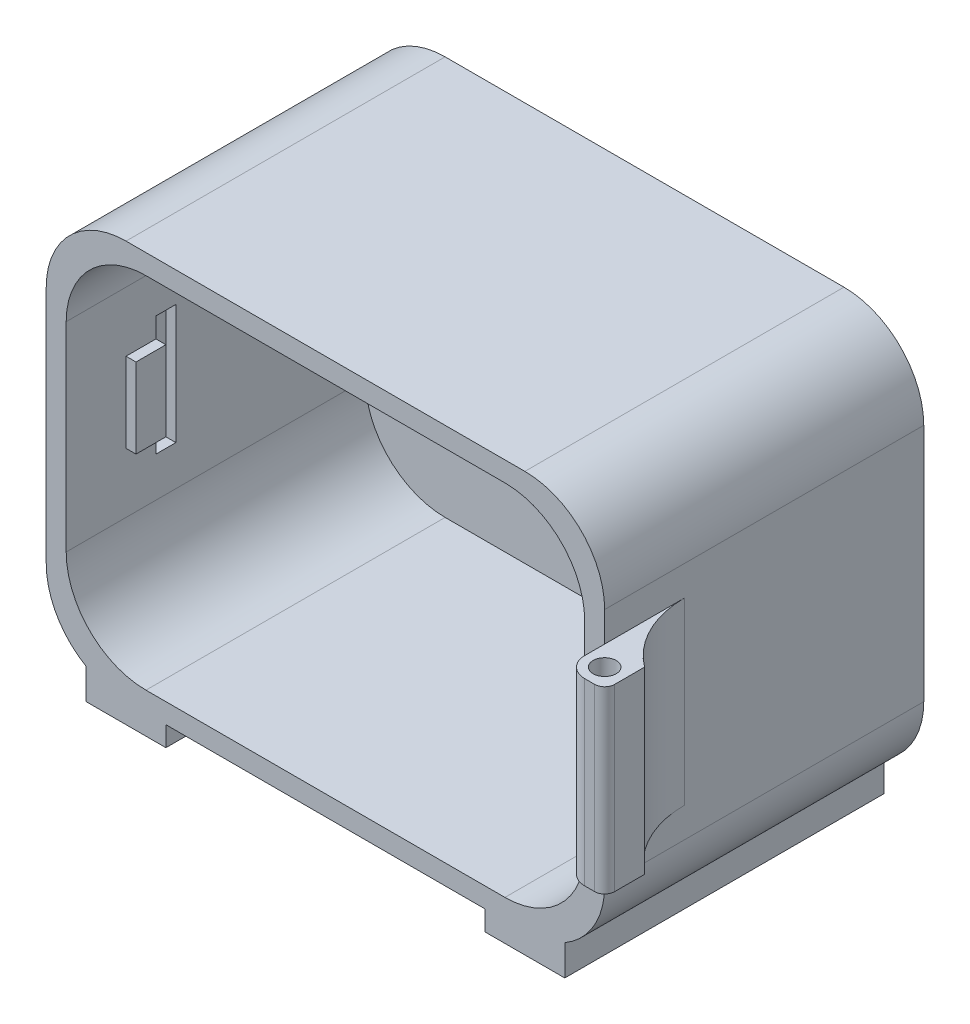
from build123d import *

# Parameters (mm, degrees)
BOSS_EXTRUDE1_DEPTH             = 95.25
BOSS_EXTRUDE2_DEPTH             = 6.35
SKETCH4_W                       = 25.4
SKETCH4_H                       = 101.6
BOSS_EXTRUDE3_DEPTH             = 6.35
BOSS_EXTRUDE3_DIRECTION_2_REACH = 187.35
BOSS_EXTRUDE5_DEPTH             = 28.575
BOSS_EXTRUDE5_DEPTH_BACK        = 28.575
SKETCH5_R                       = 3.675
FILLET1_R                       = 3.175
SKETCH8_W                       = 6.35
SKETCH8_H                       = 38.1
CUT_EXTRUDE1_DEPTH              = 3.175
SKETCH10_W                      = 9.525
SKETCH10_H                      = 25.4
BOSS_EXTRUDE6_DEPTH             = 3.175
SKETCH11_R                      = 44.824096384
CUT_EXTRUDE4_DEPTH              = 1.5875
SKETCH12_W                      = 1.13974359
SKETCH12_H                      = 13.025641026
SKETCH12_W_2                    = 4.884615385
SKETCH12_H_2                    = 1.302564103
CUT_EXTRUDE5_DEPTH              = 1.5875
FILLET2_R                       = 6.35


with BuildPart() as part:
    # Sketch1 → Boss-Extrude1 (new body)
    with BuildSketch(Plane.XY):
        with BuildLine():
            Line((-63.5, 63.5), (63.5, 63.5))
            ThreePointArc((63.5, 63.5), (81.460512242, 56.060512242), (88.9, 38.1))
            Line((88.9, 38.1), (88.9, -38.1))
            ThreePointArc((88.9, -38.1), (81.460512242, -56.060512242), (63.5, -63.5))
            Line((63.5, -63.5), (-63.5, -63.5))
            ThreePointArc((-63.5, -63.5), (-81.460512242, -56.060512242), (-88.9, -38.1))
            Line((-88.9, -38.1), (-88.9, 38.1))
            ThreePointArc((-88.9, 38.1), (-81.460512242, 56.060512242), (-63.5, 63.5))
        make_face()
        with BuildLine():
            Line((-82.55, 31.75), (-82.55, -31.75))
            ThreePointArc((-82.55, -31.75), (-75.110512242, -49.710512242), (-57.15, -57.15))
            Line((-57.15, -57.15), (57.15, -57.15))
            ThreePointArc((57.15, -57.15), (75.110512242, -49.710512242), (82.55, -31.75))
            Line((82.55, -31.75), (82.55, 31.75))
            ThreePointArc((82.55, 31.75), (75.110512242, 49.710512242), (57.15, 57.15))
            Line((57.15, 57.15), (-57.15, 57.15))
            ThreePointArc((-57.15, 57.15), (-75.110512242, 49.710512242), (-82.55, 31.75))
        make_face(mode=Mode.SUBTRACT)
    extrude(amount=-BOSS_EXTRUDE1_DEPTH)

    # Sketch2 → Boss-Extrude2 (add)
    with BuildSketch(Plane(origin=(0, 0, -95.25), x_dir=(-1, 0, 0), z_dir=(0, 0, -1))):
        with BuildLine():
            Line((-63.5, 63.5), (63.5, 63.5))
            ThreePointArc((63.5, 63.5), (81.460512242, 56.060512242), (88.9, 38.1))
            Line((88.9, 38.1), (88.9, -38.1))
            ThreePointArc((88.9, -38.1), (81.460512242, -56.060512242), (63.5, -63.5))
            Line((63.5, -63.5), (-63.5, -63.5))
            ThreePointArc((-63.5, -63.5), (-81.460512242, -56.060512242), (-88.9, -38.1))
            Line((-88.9, -38.1), (-88.9, 38.1))
            ThreePointArc((-88.9, 38.1), (-81.460512242, 56.060512242), (-63.5, 63.5))
        make_face()
    extrude(amount=BOSS_EXTRUDE2_DEPTH)

    # Sketch4 → Boss-Extrude3 (add)
    with BuildSketch(Plane.XZ.offset(63.5)):
        with Locations((-63.5, -50.8)):
            Rectangle(SKETCH4_W, SKETCH4_H)
        with Locations((63.5, -50.8)):
            Rectangle(SKETCH4_W, SKETCH4_H)
    extrude(amount=BOSS_EXTRUDE3_DEPTH)

    # Sketch4 → Boss-Extrude3 direction 2 (add, up to next)
    with BuildSketch(Plane.XZ.offset(63.5), mode=Mode.PRIVATE) as boss_extrude3_direction_2_sk1:
        with Locations((-63.5, -50.8)):
            Rectangle(SKETCH4_W, SKETCH4_H)
    boss_extrude3_direction_2_tool1 = extrude(boss_extrude3_direction_2_sk1.sketch, amount=-BOSS_EXTRUDE3_DIRECTION_2_REACH, mode=Mode.PRIVATE) - part.part
    # Sketch4 → Boss-Extrude3 direction 2 (add, up to next)
    with BuildSketch(Plane.XZ.offset(63.5), mode=Mode.PRIVATE) as boss_extrude3_direction_2_sk2:
        with Locations((63.5, -50.8)):
            Rectangle(SKETCH4_W, SKETCH4_H)
    boss_extrude3_direction_2_tool2 = extrude(boss_extrude3_direction_2_sk2.sketch, amount=-BOSS_EXTRUDE3_DIRECTION_2_REACH, mode=Mode.PRIVATE) - part.part
    add(boss_extrude3_direction_2_tool1.solids().sort_by_distance((-63.5, -63.5, -50.8))[0])
    add(boss_extrude3_direction_2_tool2.solids().sort_by_distance((63.5, -63.5, -50.8))[0])

    # Sketch5 → Boss-Extrude5 (add, two sides: drawn at the far end of the back side and taken through both)
    with BuildSketch(Plane(origin=(0, 0, 0), x_dir=(1, 0, 0), z_dir=(0, 1, 0)).offset(-BOSS_EXTRUDE5_DEPTH_BACK)):
        with BuildLine():
            ThreePointArc((101.6, 0), (92.251936686, 11.200968343), (88.9, 25.4))
            Line((88.9, 25.4), (88.9, 0))
            Line((88.9, 0), (88.9, -12.7))
            Line((88.9, -12.7), (101.6, -12.7))
            Line((101.6, -12.7), (101.6, 0))
        make_face()
        with Locations((95.25, -6.35)):
            Circle(SKETCH5_R, mode=Mode.SUBTRACT)
    extrude(amount=BOSS_EXTRUDE5_DEPTH + BOSS_EXTRUDE5_DEPTH_BACK)

    # Fillet1
    fillet1_edges = [part.edges().sort_by_distance(p)[0] for p in [
        (101.6, 0, 12.7),
    ]]
    fillet(fillet1_edges, radius=FILLET1_R)

    # Sketch8 → Cut-Extrude1 (cut)
    with BuildSketch(Plane(origin=(-82.55, 0, 0), x_dir=(0, 0, -1), z_dir=(1, 0, 0))):
        with Locations((31.75, 0)):
            Rectangle(SKETCH8_W, SKETCH8_H)
    extrude(amount=-CUT_EXTRUDE1_DEPTH, mode=Mode.SUBTRACT)

    # Sketch10 → Boss-Extrude6 (add)
    with BuildSketch(Plane(origin=(-82.55, 0, 0), x_dir=(0, 0, -1), z_dir=(1, 0, 0))):
        with Locations((23.8125, 0)):
            Rectangle(SKETCH10_W, SKETCH10_H)
    extrude(amount=BOSS_EXTRUDE6_DEPTH)

    # Sketch11 → Cut-Extrude4 (cut)
    # profile 1 of 2: a face of its own
    with BuildSketch(Plane(origin=(0, 0, -101.6), x_dir=(-1, 0, 0), z_dir=(0, 0, -1))):
        with Locations((0, 3.175)):
            Circle(SKETCH11_R)
        with BuildLine():
            Line((-8.558023622, 38.277554278), (9.414722671, 38.277554278))
            Line((9.414722671, 38.277554278), (12.376141094, 30.516595652))
            Line((12.376141094, 30.516595652), (6.555422124, 30.516595652))
            ThreePointArc((6.555422124, 30.516595652), (-1.070912861, 28.84594719), (6.555422124, 27.175298727))
            Line((6.555422124, 27.175298727), (13.309498487, 27.175298727))
            Line((13.309498487, 27.175298727), (31.249567059, -24.733260338))
            Line((31.249567059, -24.733260338), (24.338229167, -24.733260338))
            Line((24.338229167, -24.733260338), (24.338229167, -18.851270642))
            ThreePointArc((24.338229167, -18.851270642), (22.794206871, -11.23122082), (21.250184576, -18.851270642))
            Line((21.250184576, -18.851270642), (21.250184576, -24.733260338))
            Line((21.250184576, -24.733260338), (16.103443592, -24.733260338))
            Line((16.103443592, -24.733260338), (16.103443592, -18.851270642))
            ThreePointArc((16.103443592, -18.851270642), (14.239792343, -11.126064356), (12.376141094, -18.851270642))
            Line((12.376141094, -18.851270642), (12.376141094, -24.733260338))
            Line((12.376141094, -24.733260338), (10.515553381, -24.733260338))
            Line((10.515553381, -24.733260338), (8.456856988, -17.527822961))
            Line((8.456856988, -17.527822961), (-7.424515191, -17.527822961))
            Line((-7.424515191, -17.527822961), (-9.630261327, -24.733260338))
            Line((-9.630261327, -24.733260338), (-30.070175519, -24.733260338))
            Line((-30.070175519, -24.733260338), (-27.864429383, -17.527822961))
            Line((-27.864429383, -17.527822961), (-20.953091491, -17.527822961))
            ThreePointArc((-20.953091491, -17.527822961), (-12.798886715, -15.836750923), (-20.953091491, -14.145678885))
            Line((-20.953091491, -14.145678885), (-26.540981702, -14.145678885))
            Line((-26.540981702, -14.145678885), (-8.558023622, 38.277554278))
        make_face(mode=Mode.SUBTRACT)
    # profile 2 of 2: a face of its own
    with BuildSketch(Plane(origin=(0, 0, -101.6), x_dir=(-1, 0, 0), z_dir=(0, 0, -1))):
        Polygon((0.754840192, 15.029545848), (-4.852280703, -6.689071297), (6.018431459, -6.689071297), align=None)
    extrude(amount=-CUT_EXTRUDE4_DEPTH, mode=Mode.SUBTRACT)

    # Sketch12 → Cut-Extrude5 (cut)
    # profile 1 of 11: a face of its own
    with BuildSketch(Plane(origin=(0, 0, -101.6), x_dir=(-1, 0, 0), z_dir=(0, 0, -1))):
        with BuildLine():
            Line((51.288461538, -47.869230769), (52.428205128, -47.869230769))
            Line((52.428205128, -47.869230769), (52.428205128, -55.234314904))
            add(Edge.make_bspline(
                [(52.428205128, -55.234314904), (52.427199859, -55.391205604), (52.425259449, -55.694042448), (52.411285924, -56.131932206), (52.381819467, -56.536394859), (52.348405109, -56.909275054), (52.300338453, -57.248844425), (52.241641349, -57.556116225), (52.175471884, -57.831385323), (52.117341381, -58.000929746), (52.08984375, -58.081129808)],
                knots=[0, 0, 0, 0, 1.307562039, 2.523909702, 3.650326591, 4.686913197, 5.643429486, 6.506965704, 7.293745905, 8, 8, 8, 8], degree=3))
            add(Edge.make_bspline(
                [(52.08984375, -58.081129808), (52.049242798, -58.18537838), (51.969254836, -58.39075856), (51.819446966, -58.681894524), (51.651683945, -58.956019996), (51.460070878, -59.211607319), (51.245474246, -59.44737343), (51.012949975, -59.668440513), (50.757969566, -59.870131635), (50.48067881, -60.048966857), (50.187469798, -60.210028454), (49.878511085, -60.349534569), (49.555544866, -60.471043973), (49.215537231, -60.562058689), (48.863818951, -60.640924675), (48.496253987, -60.692249677), (48.114989839, -60.727182146), (47.855745174, -60.730412419), (47.72421875, -60.732051282)],
                knots=[0, 0, 0, 0, 0.981931301, 1.934503488, 2.87077864, 3.801706999, 4.735015492, 5.667491629, 6.616593066, 7.585388521, 8.561939025, 9.551802639, 10.560317337, 11.588439944, 12.640189604, 13.723962949, 14.845264515, 16, 16, 16, 16], degree=3))
            add(Edge.make_bspline(
                [(47.72421875, -60.732051282), (47.532322713, -60.728943462), (47.157498196, -60.722873055), (46.611017223, -60.652148877), (46.092005525, -60.552165866), (45.607321067, -60.400834743), (45.160026716, -60.21564338), (44.753177225, -60.003027408), (44.39042492, -59.759226202), (44.063404735, -59.481638307), (43.768250965, -59.151570091), (43.490566228, -58.762591428), (43.223282238, -58.308777287), (43.066641753, -57.975700871), (42.984615385, -57.801282051)],
                knots=[0, 0, 0, 0, 1.157897085, 2.2616841, 3.32207898, 4.345638746, 5.321241055, 6.241986252, 7.112515963, 7.955008012, 8.825025602, 9.77857164, 10.836726669, 12, 12, 12, 12], degree=3))
            Line((42.984615385, -57.801282051), (44.124358974, -57.801282051))
            add(Edge.make_bspline(
                [(44.124358974, -57.801282051), (44.216024705, -57.946809086), (44.395219921, -58.231296519), (44.730312981, -58.599644257), (45.097547365, -58.914435037), (45.509316501, -59.168111274), (45.967333711, -59.359372517), (46.471874544, -59.495717165), (47.0270446, -59.577346476), (47.413553549, -59.5871846), (47.614823718, -59.592307692)],
                knots=[0, 0, 0, 0, 0.997731894, 1.950442991, 2.880492273, 3.800895997, 4.748200782, 5.754801363, 6.83083817, 8, 8, 8, 8], degree=3))
            add(Edge.make_bspline(
                [(47.614823718, -59.592307692), (47.813549291, -59.587118295), (48.196672306, -59.577113657), (48.747602548, -59.495680734), (49.25050418, -59.359342846), (49.702479765, -59.168449559), (50.098196411, -58.934586655), (50.439325637, -58.673329242), (50.715622033, -58.378758174), (50.90145194, -58.107407049), (51.016966124, -57.865656635), (51.090525383, -57.657548644), (51.150302358, -57.422225345), (51.200303483, -57.160475674), (51.241563654, -56.871925661), (51.267699828, -56.55591554), (51.286589487, -56.213163505), (51.287823092, -55.975516975), (51.288461538, -55.852524038)],
                knots=[0, 0, 0, 0, 1.570740765, 3.028230971, 4.391408896, 5.680370741, 6.894727393, 8.017376726, 9.065722033, 10.075533815, 10.603371122, 11.180248986, 11.817768598, 12.521299649, 13.286540596, 14.121245857, 15.027658897, 16, 16, 16, 16], degree=3))
            Line((51.288461538, -55.852524038), (51.288461538, -55.371694712))
            add(Edge.make_bspline(
                [(51.288461538, -55.371694712), (51.172778627, -55.509369251), (50.94344763, -55.782296676), (50.547398758, -56.139934615), (50.114811664, -56.447950002), (49.64642281, -56.70056619), (49.153705474, -56.902610217), (48.641996238, -57.043917532), (48.115882209, -57.135212026), (47.759367265, -57.145035716), (47.579206731, -57.15)],
                knots=[0, 0, 0, 0, 1.012485704, 2.007162095, 2.997754123, 3.998611389, 4.999708251, 5.992315798, 6.98544096, 8, 8, 8, 8], degree=3))
            add(Edge.make_bspline(
                [(47.579206731, -57.15), (47.473120839, -57.14813119), (47.262204473, -57.144415684), (46.948860104, -57.111908121), (46.640139657, -57.064741256), (46.336763132, -56.995502891), (46.038292765, -56.906632912), (45.745221788, -56.795537889), (45.455177277, -56.66993446), (45.173431413, -56.52198743), (44.90279031, -56.357387059), (44.645295324, -56.179083085), (44.402295197, -55.988008724), (44.176102792, -55.782279829), (43.967014813, -55.562194153), (43.772219063, -55.330097832), (43.594936689, -55.082749942), (43.43152982, -54.824660696), (43.289806709, -54.554111058), (43.165403416, -54.276967683), (43.057237861, -53.993823162), (42.971003403, -53.703729535), (42.905140792, -53.406869688), (42.856117969, -53.103729945), (42.828312474, -52.793376824), (42.823976607, -52.584293643), (42.821794872, -52.479086538)],
                knots=[0, 0, 0, 0, 1.028754217, 2.045334182, 3.052854819, 4.056607503, 5.061168794, 6.071104265, 7.095078842, 8.125279047, 9.155117945, 10.165957491, 11.161587969, 12.151493252, 13.128948131, 14.104219989, 15.088194871, 16.07871515, 17.064853787, 18.047899887, 19.02414258, 20.002704429, 20.980574569, 21.971845993, 22.979467364, 24, 24, 24, 24], degree=3))
            add(Edge.make_bspline(
                [(42.821794872, -52.479086538), (42.823678704, -52.373846733), (42.827439071, -52.163774731), (42.859918339, -51.852155247), (42.906248626, -51.544708439), (42.97957396, -51.244603296), (43.06782997, -50.948422054), (43.177135505, -50.658352398), (43.30855786, -50.374305979), (43.457364666, -50.096072451), (43.624584088, -49.827385391), (43.807944804, -49.572200133), (44.007668176, -49.332394481), (44.220998841, -49.105549178), (44.450541606, -48.893852903), (44.696177721, -48.697819459), (44.955485887, -48.514162849), (45.229269765, -48.346844569), (45.513304861, -48.198863274), (45.800375, -48.063834708), (46.094282881, -47.956668046), (46.389548953, -47.862241372), (46.691373215, -47.79534795), (46.9960549, -47.743741529), (47.304637097, -47.71230097), (47.511294745, -47.708376362), (47.614823718, -47.706410256)],
                knots=[0, 0, 0, 0, 1.008818848, 2.013730394, 3.001654427, 3.987803273, 4.973046549, 5.963777569, 6.957074694, 7.972068341, 8.987420212, 9.989399531, 10.982630087, 11.977756091, 12.973280677, 13.973972381, 14.989194003, 16.018387222, 17.047741039, 18.059210846, 19.057554164, 20.045176975, 21.029480261, 22.018708529, 23.007435371, 24, 24, 24, 24], degree=3))
            add(Edge.make_bspline(
                [(47.614823718, -47.706410256), (47.785551411, -47.711333042), (48.122686145, -47.721054032), (48.618824354, -47.797330759), (49.097586196, -47.918938751), (49.561673282, -48.093166896), (50.014866073, -48.331019892), (50.455670936, -48.644321446), (50.885363223, -49.035881822), (51.150531351, -49.336156501), (51.288461538, -49.492347756)],
                knots=[0, 0, 0, 0, 0.96728863, 1.910097829, 2.838038873, 3.762875196, 4.71315279, 5.730631239, 6.819562287, 8, 8, 8, 8], degree=3))
            Line((51.288461538, -49.492347756), (51.288461538, -47.869230769))
        make_face()
        with BuildLine():
            add(Edge.make_bspline(
                [(47.706410256, -48.846153846), (47.539747417, -48.851818284), (47.209790334, -48.863032669), (46.726144062, -48.958771486), (46.259230618, -49.108798037), (45.817976636, -49.323401242), (45.404656551, -49.585000334), (45.037899346, -49.901920806), (44.717115793, -50.263857006), (44.44576056, -50.667536474), (44.229746744, -51.103045873), (44.076826336, -51.562099108), (43.97794768, -52.037278654), (43.9670342, -52.361573528), (43.961538462, -52.524879808)],
                knots=[0, 0, 0, 0, 1.026226791, 2.031711442, 3.026614839, 4.04107745, 5.047145931, 6.032893242, 7.017642609, 8.019221815, 9.021877557, 10.003543541, 10.994637589, 12, 12, 12, 12], degree=3))
            add(Edge.make_bspline(
                [(43.961538462, -52.524879808), (43.964171922, -52.648009111), (43.969351169, -52.890168444), (44.019148151, -53.24554309), (44.099633367, -53.584017371), (44.213705516, -53.905611758), (44.355048152, -54.212170871), (44.532820469, -54.501582952), (44.742011138, -54.774105742), (44.980982821, -55.027723588), (45.244331407, -55.258721959), (45.529969644, -55.461697135), (45.837510122, -55.627706894), (46.159389119, -55.771183647), (46.503416719, -55.875973408), (46.864637689, -55.955942692), (47.245607559, -56.001694469), (47.505310727, -56.007365193), (47.637720353, -56.01025641)],
                knots=[0, 0, 0, 0, 1.039728707, 2.044842319, 3.024901384, 3.974314358, 4.923051295, 5.871625912, 6.837440708, 7.820715446, 8.810779094, 9.792721783, 10.773906224, 11.758876063, 12.764959493, 13.806266761, 14.881525401, 16, 16, 16, 16], degree=3))
            add(Edge.make_bspline(
                [(47.637720353, -56.01025641), (47.771845989, -56.007471086), (48.034127251, -56.002024414), (48.417198935, -55.955203148), (48.780174878, -55.87964912), (49.122722262, -55.772377571), (49.446134443, -55.635501504), (49.74677833, -55.462285778), (50.031100299, -55.265020553), (50.290022128, -55.03492553), (50.524152671, -54.781342834), (50.728190025, -54.5054085), (50.902051026, -54.211274617), (51.046024285, -53.898974339), (51.155938083, -53.566080658), (51.229666681, -53.213425767), (51.281216871, -52.8426992), (51.286009941, -52.588667936), (51.288461538, -52.458733974)],
                knots=[0, 0, 0, 0, 1.121943988, 2.193949579, 3.223793937, 4.220241907, 5.192961521, 6.155822191, 7.11847367, 8.083710714, 9.04790392, 10.001595906, 10.949595423, 11.902125208, 12.873731292, 13.87582262, 14.913508608, 16, 16, 16, 16], degree=3))
            add(Edge.make_bspline(
                [(51.288461538, -52.458733974), (51.28360082, -52.289577761), (51.274104683, -51.959105963), (51.184489283, -51.477569977), (51.039998806, -51.024837932), (50.837354876, -50.602341676), (50.583420159, -50.214557882), (50.277564793, -49.868668503), (49.925063482, -49.564228252), (49.526929004, -49.310597664), (49.098585417, -49.105708802), (48.650379935, -48.951996086), (48.182977974, -48.864931), (47.866180431, -48.85244892), (47.706410256, -48.846153846)],
                knots=[0, 0, 0, 0, 1.070913519, 2.092188694, 3.091357305, 4.074328408, 5.051968682, 6.018948707, 6.99050112, 7.9935919, 9.000589572, 9.992915277, 10.987769056, 12, 12, 12, 12], degree=3))
        make_face(mode=Mode.SUBTRACT)
    # profile 2 of 11: a face of its own
    with BuildSketch(Plane(origin=(0, 0, -101.6), x_dir=(-1, 0, 0), z_dir=(0, 0, -1))):
        with BuildLine():
            Line((37.611538462, -47.869230769), (38.751282051, -47.869230769))
            Line((38.751282051, -47.869230769), (38.751282051, -49.235396635))
            add(Edge.make_bspline(
                [(38.751282051, -49.235396635), (38.835424119, -49.108194058), (38.996345169, -48.864920117), (39.263817798, -48.543177225), (39.537787029, -48.276785485), (39.819564423, -48.064501288), (40.1112221, -47.905522257), (40.406359039, -47.789070387), (40.709618601, -47.720209843), (40.913406155, -47.71101628), (41.015504808, -47.706410256)],
                knots=[0, 0, 0, 0, 1.2804753, 2.448899062, 3.506932113, 4.484331642, 5.4025378, 6.288909075, 7.142734305, 8, 8, 8, 8], degree=3))
            add(Edge.make_bspline(
                [(41.015504808, -47.706410256), (41.094703192, -47.710730167), (41.257659016, -47.719618664), (41.504338699, -47.782069371), (41.758496367, -47.881775338), (41.922298744, -47.975538432), (42.007692308, -48.024419071)],
                knots=[0, 0, 0, 0, 0.901110191, 1.854092781, 2.881294221, 4, 4, 4, 4], degree=3))
            Line((42.007692308, -48.024419071), (41.381850962, -49.011518429))
            add(Edge.make_bspline(
                [(41.381850962, -49.011518429), (41.327026799, -48.987060892), (41.222960044, -48.940635805), (41.070724903, -48.88569194), (40.93036691, -48.853339902), (40.840945998, -48.848438728), (40.799258814, -48.846153846)],
                knots=[0, 0, 0, 0, 1.180555205, 2.24091978, 3.179933427, 4, 4, 4, 4], degree=3))
            add(Edge.make_bspline(
                [(40.799258814, -48.846153846), (40.70779801, -48.852249982), (40.52124448, -48.864684331), (40.247343582, -48.962433719), (39.981560865, -49.120368162), (39.770480833, -49.295523339), (39.607041802, -49.464425347), (39.490418698, -49.61192098), (39.383438444, -49.7773063), (39.281220787, -49.957754009), (39.188088806, -50.156345165), (39.101167577, -50.371095682), (39.022576846, -50.602254292), (38.977763103, -50.763299437), (38.954807692, -50.845793269)],
                knots=[0, 0, 0, 0, 1.125678352, 2.296057538, 3.5422874, 4.923748041, 5.663163013, 6.437101912, 7.23742474, 8.08941207, 8.991984279, 9.93940061, 10.944477711, 12, 12, 12, 12], degree=3))
            add(Edge.make_bspline(
                [(38.954807692, -50.845793269), (38.937635865, -50.919370442), (38.899601572, -51.082338288), (38.862620849, -51.355745792), (38.826082884, -51.678774497), (38.800332297, -52.052323563), (38.776463402, -52.475460145), (38.763001103, -52.948828862), (38.751741136, -53.472915593), (38.751439722, -53.839308246), (38.751282051, -54.030969551)],
                knots=[0, 0, 0, 0, 0.566838948, 1.255505196, 2.06880316, 3.007127437, 4.065329342, 5.249902469, 6.561414163, 8, 8, 8, 8], degree=3))
            Line((38.751282051, -54.030969551), (38.751282051, -57.15))
            Line((38.751282051, -57.15), (37.611538462, -57.15))
            Line((37.611538462, -57.15), (37.611538462, -47.869230769))
        make_face()
    # profile 3 of 11: a face of its own
    with BuildSketch(Plane(origin=(0, 0, -101.6), x_dir=(-1, 0, 0), z_dir=(0, 0, -1))):
        with BuildLine():
            add(Edge.make_bspline(
                [(30.859575321, -47.706410256), (31.033715082, -47.710118261), (31.375160597, -47.717388753), (31.875206354, -47.795094486), (32.352527276, -47.913920636), (32.808951459, -48.078191733), (33.238633445, -48.298380525), (33.647831959, -48.56112281), (34.035425106, -48.872391078), (34.267737241, -49.113176069), (34.385657051, -49.235396635)],
                knots=[0, 0, 0, 0, 1.054011418, 2.066658804, 3.057071809, 4.030435133, 4.997543892, 5.974964718, 6.972108034, 8, 8, 8, 8], degree=3))
            add(Edge.make_bspline(
                [(34.385657051, -49.235396635), (34.48719157, -49.352287383), (34.688295636, -49.583806722), (34.946162673, -49.959202803), (35.168309477, -50.347968311), (35.346337935, -50.755265754), (35.486709307, -51.17753956), (35.586370547, -51.616241144), (35.645650283, -52.070401661), (35.653643906, -52.378844159), (35.657692308, -52.53505609)],
                knots=[0, 0, 0, 0, 1.025258237, 2.030674902, 3.01204498, 3.988269485, 4.97094183, 5.956517959, 6.965070386, 8, 8, 8, 8], degree=3))
            add(Edge.make_bspline(
                [(35.657692308, -52.53505609), (35.654131455, -52.692173442), (35.647095044, -53.002644657), (35.580533922, -53.459914927), (35.477006839, -53.90330757), (35.328845598, -54.330966258), (35.138860458, -54.744198232), (34.907028535, -55.141198597), (34.631722953, -55.522750623), (34.319651307, -55.885614436), (33.974748785, -56.22004613), (33.600584476, -56.511522994), (33.204511268, -56.761246811), (32.781262529, -56.962401804), (32.334703362, -57.121005574), (31.863870572, -57.232402777), (31.369495603, -57.299755172), (31.031939685, -57.308404138), (30.859575321, -57.312820513)],
                knots=[0, 0, 0, 0, 0.998656419, 1.973391657, 2.932242238, 3.890759089, 4.846373663, 5.82037756, 6.809684879, 7.83454468, 8.860553229, 9.859544525, 10.845671541, 11.83227036, 12.833544569, 13.85385346, 14.904124723, 16, 16, 16, 16], degree=3))
            add(Edge.make_bspline(
                [(30.859575321, -57.312820513), (30.686366481, -57.308389315), (30.347128219, -57.299710591), (29.851008227, -57.23266445), (29.37933161, -57.121056914), (28.932187838, -56.961880583), (28.507119393, -56.761240381), (28.108751247, -56.512277965), (27.734282983, -56.219959687), (27.389307496, -55.885637858), (27.077255414, -55.522744588), (26.801944784, -55.141200163), (26.570114172, -54.744197824), (26.380128689, -54.330966367), (26.231967539, -53.90330754), (26.128440432, -53.459914935), (26.061879316, -53.002644655), (26.054842904, -52.692173441), (26.051282051, -52.53505609)],
                knots=[0, 0, 0, 0, 1.099876186, 2.154163076, 3.173186993, 4.173200201, 5.163417411, 6.152872554, 7.150605724, 8.17532212, 9.198891216, 10.186952605, 11.159729845, 12.11414092, 13.071450619, 14.029093627, 15.002601286, 16, 16, 16, 16], degree=3))
            add(Edge.make_bspline(
                [(26.051282051, -52.53505609), (26.055358063, -52.379693195), (26.063427866, -52.072101363), (26.122647999, -51.6187946), (26.221920475, -51.180835503), (26.362460114, -50.760191633), (26.542129521, -50.35467905), (26.761154766, -49.964952949), (27.021652204, -49.591254359), (27.221956428, -49.36003424), (27.323317308, -49.243028846)],
                knots=[0, 0, 0, 0, 1.031353054, 2.041901799, 3.029428768, 4.008703097, 4.981709435, 5.96992636, 6.972712378, 8, 8, 8, 8], degree=3))
            add(Edge.make_bspline(
                [(27.323317308, -49.243028846), (27.441059338, -49.119748352), (27.672619758, -48.877295569), (28.062142285, -48.566934696), (28.47033415, -48.298724942), (28.904764596, -48.082911246), (29.360813823, -47.912954339), (29.840580789, -47.794788041), (30.342323374, -47.717668724), (30.685439713, -47.710200479), (30.859575321, -47.706410256)],
                knots=[0, 0, 0, 0, 1.027980169, 2.021703884, 2.998553061, 3.971491411, 4.943284454, 5.930300938, 6.949603206, 8, 8, 8, 8], degree=3))
        make_face()
        with BuildLine():
            add(Edge.make_bspline(
                [(30.854487179, -48.846153846), (30.731342133, -48.849653936), (30.488231009, -48.856563761), (30.130382801, -48.909119644), (29.785885671, -48.992386302), (29.454086037, -49.110692449), (29.136102811, -49.26345131), (28.831631551, -49.451078789), (28.539776698, -49.671089802), (28.266247496, -49.923140068), (28.015214535, -50.19847242), (27.795765877, -50.491836465), (27.609166206, -50.798473778), (27.453717629, -51.11870323), (27.337940118, -51.455769989), (27.25385515, -51.805856851), (27.201348849, -52.169677077), (27.19450399, -52.4170042), (27.191025641, -52.542688301)],
                knots=[0, 0, 0, 0, 1.021534396, 2.016698045, 2.994645724, 3.958388632, 4.93408049, 5.916473867, 6.921342795, 7.962252576, 8.998418191, 10.008913653, 10.997312074, 11.973003931, 12.956656626, 13.948281152, 14.957379055, 16, 16, 16, 16], degree=3))
            add(Edge.make_bspline(
                [(27.191025641, -52.542688301), (27.196856115, -52.705074228), (27.208428517, -53.027379928), (27.302536375, -53.502037431), (27.45996659, -53.957720151), (27.672554719, -54.391756752), (27.938914427, -54.793339018), (28.252738926, -55.151375547), (28.610660125, -55.460478348), (29.008411425, -55.716948845), (29.437868522, -55.92072853), (29.89237003, -56.065141956), (30.36640912, -56.15901924), (30.69037063, -56.168350018), (30.854487179, -56.173076923)],
                knots=[0, 0, 0, 0, 1.016792936, 2.018143844, 3.017858371, 4.030088057, 5.03801393, 6.028138512, 7.003788237, 7.991172063, 8.984598303, 9.972568034, 10.972917682, 12, 12, 12, 12], degree=3))
            add(Edge.make_bspline(
                [(30.854487179, -56.173076923), (31.01859429, -56.168322478), (31.342537166, -56.158937334), (31.815917608, -56.06561476), (32.269176877, -55.920095762), (32.698187912, -55.717178029), (33.095758159, -55.45950441), (33.456253542, -55.153120985), (33.767398502, -54.792390724), (34.033494726, -54.391224834), (34.249564335, -53.958393042), (34.406257667, -53.501953328), (34.500591765, -53.027401347), (34.512133629, -52.705081404), (34.517948718, -52.542688301)],
                knots=[0, 0, 0, 0, 1.02726834, 2.027799167, 3.010890988, 4.004497153, 4.992059811, 5.971914811, 6.958719428, 7.966827853, 8.981595046, 9.981490638, 10.983022906, 12, 12, 12, 12], degree=3))
            add(Edge.make_bspline(
                [(34.517948718, -52.542688301), (34.514471567, -52.417003449), (34.507629064, -52.169674847), (34.455105622, -51.805865373), (34.371084092, -51.455738722), (34.255072795, -51.118818596), (34.100299659, -50.797644652), (33.910101582, -50.492736785), (33.691549004, -50.197456175), (33.437486879, -49.924030107), (33.164243194, -49.670991546), (32.872270055, -49.450993476), (32.568250276, -49.264275915), (32.251190847, -49.109385842), (31.919348673, -48.993462636), (31.575334233, -48.908638858), (31.219012837, -48.856785859), (30.97677288, -48.849720517), (30.854487179, -48.846153846)],
                knots=[0, 0, 0, 0, 1.042956736, 2.052379634, 3.044323526, 4.02829302, 5.004299113, 5.996692471, 7.007513377, 8.048758398, 9.090003419, 10.095195979, 11.07790575, 12.047570684, 13.018257071, 13.989683339, 14.985167495, 16, 16, 16, 16], degree=3))
        make_face(mode=Mode.SUBTRACT)
    # profile 4 of 11: a face of its own
    with BuildSketch(Plane(origin=(0, 0, -101.6), x_dir=(-1, 0, 0), z_dir=(0, 0, -1))):
        with BuildLine():
            add(Edge.make_bspline(
                [(22.876282051, -55.196153846), (22.947003678, -55.200356337), (23.08564516, -55.208594828), (23.286084283, -55.265115901), (23.467493477, -55.365477327), (23.629081908, -55.499236551), (23.76227398, -55.661417957), (23.866212057, -55.841380255), (23.922240775, -56.043497462), (23.930419255, -56.182942283), (23.934615385, -56.254487179)],
                knots=[0, 0, 0, 0, 1.020151414, 1.999887582, 2.974338812, 3.990962822, 5.007586832, 5.987933904, 6.967670073, 8, 8, 8, 8], degree=3))
            add(Edge.make_bspline(
                [(23.934615385, -56.254487179), (23.930277062, -56.324312976), (23.921721953, -56.462008421), (23.866340489, -56.662601157), (23.76148185, -56.842675925), (23.63000059, -57.007057969), (23.467453531, -57.141100557), (23.285655403, -57.240608122), (23.086115694, -57.301176163), (22.947082178, -57.308891584), (22.876282051, -57.312820513)],
                knots=[0, 0, 0, 0, 1.009421747, 1.99056486, 2.972319754, 3.999869655, 5.017953583, 5.993804169, 6.978383603, 8, 8, 8, 8], degree=3))
            add(Edge.make_bspline(
                [(22.876282051, -57.312820513), (22.805430908, -57.309033746), (22.667110917, -57.301640985), (22.468316023, -57.239364517), (22.285410737, -57.142033675), (22.122895326, -57.006808032), (21.990312872, -56.843521797), (21.890072197, -56.661360993), (21.829873657, -56.462582635), (21.821956576, -56.324426073), (21.817948718, -56.254487179)],
                knots=[0, 0, 0, 0, 1.022052826, 1.995314843, 2.982371812, 4.00089066, 5.028879526, 6.005146991, 6.990147033, 8, 8, 8, 8], degree=3))
            add(Edge.make_bspline(
                [(21.817948718, -56.254487179), (21.821802621, -56.182825145), (21.829326894, -56.042913817), (21.890198575, -55.842619912), (21.989535115, -55.660580147), (22.123811834, -55.499483985), (22.285371422, -55.364547201), (22.467874795, -55.266340666), (22.667589699, -55.208136885), (22.805511475, -55.200217467), (22.876282051, -55.196153846)],
                knots=[0, 0, 0, 0, 1.032775665, 2.016367738, 2.991239715, 4.008302682, 5.025365648, 6.011011707, 6.979408107, 8, 8, 8, 8], degree=3))
        make_face()
    # profile 5 of 11: a face of its own
    with BuildSketch(Plane(origin=(0, 0, -101.6), x_dir=(-1, 0, 0), z_dir=(0, 0, -1))):
        with BuildLine():
            Line((9.606410256, -57.15), (9.606410256, -44.124358974))
            Line((9.606410256, -44.124358974), (10.746153846, -44.124358974))
            Line((10.746153846, -44.124358974), (10.746153846, -49.553405449))
            add(Edge.make_bspline(
                [(10.746153846, -49.553405449), (10.874581395, -49.405512382), (11.125148837, -49.116966911), (11.54525196, -48.740148296), (11.985780741, -48.420643593), (12.450086412, -48.157259677), (12.938829341, -47.956695446), (13.44948585, -47.810019917), (13.98336134, -47.721530297), (14.347376629, -47.711493403), (14.531730769, -47.706410256)],
                knots=[0, 0, 0, 0, 1.077089805, 2.101446609, 3.097517232, 4.067117542, 5.031729543, 5.997785507, 6.985986182, 8, 8, 8, 8], degree=3))
            add(Edge.make_bspline(
                [(14.531730769, -47.706410256), (14.695619326, -47.710910513), (15.019654935, -47.719808287), (15.496021583, -47.787424885), (15.954358324, -47.897072337), (16.394415675, -48.049081102), (16.81414027, -48.250767906), (17.217125991, -48.492217794), (17.601308192, -48.779739731), (17.96073592, -49.108482173), (18.292002307, -49.465376204), (18.581970558, -49.847030491), (18.826898027, -50.247897247), (19.02948586, -50.666634617), (19.186135109, -51.104952805), (19.29405705, -51.56242204), (19.362613335, -52.038592279), (19.371250228, -52.362670166), (19.375641026, -52.527423878)],
                knots=[0, 0, 0, 0, 1.034377878, 2.045141349, 3.03070803, 4.00595497, 4.978199603, 5.965204761, 6.967410914, 8.002051993, 9.036360596, 10.037508045, 11.022711142, 11.997267194, 12.969246472, 13.954813154, 14.960274251, 16, 16, 16, 16], degree=3))
            add(Edge.make_bspline(
                [(19.375641026, -52.527423878), (19.371154513, -52.689621085), (19.362307816, -53.009448434), (19.29473907, -53.480097938), (19.183174052, -53.933084075), (19.023657758, -54.367236323), (18.823124981, -54.784594294), (18.572349781, -55.180400332), (18.282749868, -55.561541758), (17.947719701, -55.915776078), (17.585176237, -56.243194415), (17.19723027, -56.527695697), (16.793653583, -56.773412104), (16.368156005, -56.968104728), (15.927037683, -57.125588072), (15.465572708, -57.234872264), (14.986371852, -57.298637349), (14.660820457, -57.30805555), (14.496113782, -57.312820513)],
                knots=[0, 0, 0, 0, 1.024244038, 2.01964794, 2.996620209, 3.965911562, 4.936179293, 5.91563013, 6.920572822, 7.955171681, 8.990768464, 10.002129126, 10.989675881, 11.969873457, 12.952483066, 13.943799762, 14.959703725, 16, 16, 16, 16], degree=3))
            add(Edge.make_bspline(
                [(14.496113782, -57.312820513), (14.30755466, -57.307593163), (13.9378231, -57.297343241), (13.396974858, -57.212365802), (12.885050378, -57.067725103), (12.396218131, -56.873372446), (11.937466108, -56.610197044), (11.505881709, -56.28378255), (11.104186614, -55.888750369), (10.867542741, -55.58735582), (10.746153846, -55.432752404)],
                knots=[0, 0, 0, 0, 1.035807596, 2.031038093, 2.998900396, 3.954262848, 4.914341711, 5.895762244, 6.92060972, 8, 8, 8, 8], degree=3))
            Line((10.746153846, -55.432752404), (10.746153846, -57.15))
            Line((10.746153846, -57.15), (9.606410256, -57.15))
        make_face()
        with BuildLine():
            add(Edge.make_bspline(
                [(14.4859375, -56.173076923), (14.652541008, -56.167149184), (14.981389832, -56.15544877), (15.464148729, -56.06410448), (15.926117432, -55.912124982), (16.364968045, -55.704266954), (16.773832977, -55.442929856), (17.139058249, -55.126713752), (17.463741766, -54.765665399), (17.734621068, -54.358417426), (17.960776298, -53.924981052), (18.116127329, -53.469035444), (18.220338889, -53.002782924), (18.230688657, -52.686567277), (18.235897436, -52.527423878)],
                knots=[0, 0, 0, 0, 1.031910345, 2.036826888, 3.032245421, 4.038315463, 5.03827337, 6.029480047, 7.023177075, 8.037597977, 9.052889626, 10.043399556, 11.015292101, 12, 12, 12, 12], degree=3))
            add(Edge.make_bspline(
                [(18.235897436, -52.527423878), (18.229047622, -52.368436055), (18.215375342, -52.051095128), (18.119672559, -51.58065205), (17.952548578, -51.124948383), (17.730777466, -50.685245396), (17.455485062, -50.275188521), (17.132520565, -49.906924345), (16.762835155, -49.589206688), (16.353447319, -49.324357001), (15.917364913, -49.108240909), (15.458384613, -48.960031816), (14.986096568, -48.863010394), (14.665347208, -48.851801271), (14.503745994, -48.846153846)],
                knots=[0, 0, 0, 0, 0.984795267, 1.965658976, 2.959410029, 3.983795688, 5.009594896, 6.01088574, 7.009236619, 8.019050059, 9.024672985, 10.014834719, 10.999826153, 12, 12, 12, 12], degree=3))
            add(Edge.make_bspline(
                [(14.503745994, -48.846153846), (14.338763895, -48.85179808), (14.011307906, -48.863000738), (13.5280975, -48.960202271), (13.056153584, -49.109146461), (12.605167397, -49.322983071), (12.184782682, -49.584644657), (11.808816917, -49.892130523), (11.48467098, -50.243303333), (11.217812154, -50.637024385), (11.00588617, -51.062238657), (10.854270855, -51.515854366), (10.763557852, -51.9954837), (10.752025771, -52.32435276), (10.746153846, -52.491806891)],
                knots=[0, 0, 0, 0, 1.016820015, 2.018181405, 3.029022337, 4.06341356, 5.088169224, 6.076823655, 7.05054209, 8.02560866, 9.001194327, 9.972267242, 10.967515442, 12, 12, 12, 12], degree=3))
            add(Edge.make_bspline(
                [(10.746153846, -52.491806891), (10.749636079, -52.620032689), (10.756490215, -52.872421638), (10.808851838, -53.242999258), (10.892148096, -53.597630765), (11.009508775, -53.936702605), (11.16372754, -54.258289972), (11.349547648, -54.564890034), (11.57071505, -54.853736216), (11.820747532, -55.124120378), (12.096382456, -55.370171681), (12.392194915, -55.58345267), (12.702139979, -55.767109874), (13.029763587, -55.913504017), (13.371253127, -56.032980249), (13.730112822, -56.111842697), (14.102663419, -56.166180696), (14.356834314, -56.170753977), (14.4859375, -56.173076923)],
                knots=[0, 0, 0, 0, 1.050331198, 2.067384183, 3.060053655, 4.031335885, 5.001026174, 5.976994447, 6.963687968, 7.976578778, 8.990422448, 9.985569286, 10.960374351, 11.936812464, 12.921228065, 13.919088064, 14.943024695, 16, 16, 16, 16], degree=3))
        make_face(mode=Mode.SUBTRACT)
    # profile 6 of 11: a face of its own
    with BuildSketch(Plane(origin=(0, 0, -101.6), x_dir=(-1, 0, 0), z_dir=(0, 0, -1))):
        with BuildLine():
            Line((7.001282051, -47.869230769), (7.001282051, -57.15))
            Line((7.001282051, -57.15), (5.861538462, -57.15))
            Line((5.861538462, -57.15), (5.861538462, -55.544691506))
            add(Edge.make_bspline(
                [(5.861538462, -55.544691506), (5.73301885, -55.689978033), (5.482211212, -55.973506517), (5.063324869, -56.343918971), (4.619303195, -56.650091738), (4.152301258, -56.897378575), (3.662740775, -57.083132608), (3.151706973, -57.215162385), (2.618991391, -57.300048587), (2.255218561, -57.308525009), (2.070873397, -57.312820513)],
                knots=[0, 0, 0, 0, 1.074387032, 2.096679803, 3.090159297, 4.057316773, 5.018401886, 5.985159533, 6.978961417, 8, 8, 8, 8], degree=3))
            add(Edge.make_bspline(
                [(2.070873397, -57.312820513), (1.906978251, -57.308370533), (1.583769764, -57.299594977), (1.108321399, -57.231514618), (0.650786665, -57.122183505), (0.210733216, -56.970143135), (-0.208991426, -56.768464154), (-0.61198092, -56.527014482), (-0.996147545, -56.23948347), (-1.355635701, -55.910778339), (-1.686677531, -55.553745099), (-1.977185577, -55.172942687), (-2.219403896, -54.770017755), (-2.421951046, -54.35007174), (-2.577966353, -53.909871889), (-2.686727825, -53.450940451), (-2.754728875, -52.973820053), (-2.763500804, -52.648919497), (-2.767948718, -52.484174679)],
                knots=[0, 0, 0, 0, 1.033919861, 2.038935746, 3.024066025, 3.998881131, 4.97069526, 5.957263378, 6.95902576, 7.993208707, 9.027059324, 10.027763471, 11.009749337, 11.988697705, 12.965288445, 13.950418724, 14.960734635, 16, 16, 16, 16], degree=3))
            add(Edge.make_bspline(
                [(-2.767948718, -52.484174679), (-2.763402222, -52.322834955), (-2.754414044, -52.003875024), (-2.687455218, -51.534778034), (-2.574856986, -51.082954631), (-2.416840511, -50.649859437), (-2.214213988, -50.234968397), (-1.967732073, -49.837988078), (-1.677376963, -49.457824836), (-1.342632515, -49.103417813), (-0.980012063, -48.77604587), (-0.592086096, -48.491533048), (-0.188504476, -48.245817625), (0.236992734, -48.051132154), (0.678107657, -47.893619117), (1.138767303, -47.784642347), (1.617055032, -47.720426353), (1.941777674, -47.71112718), (2.106490385, -47.706410256)],
                knots=[0, 0, 0, 0, 1.020392517, 2.01726096, 2.990465484, 3.961182959, 4.928053699, 5.906110375, 6.912531644, 7.948652711, 8.985773172, 9.998621852, 10.987621588, 11.969261332, 12.953316658, 13.946091881, 14.958173133, 16, 16, 16, 16], degree=3))
            add(Edge.make_bspline(
                [(2.106490385, -47.706410256), (2.295901302, -47.711627241), (2.667327171, -47.7218575), (3.210625947, -47.806993682), (3.724593053, -47.950824692), (4.213195987, -48.146468185), (4.674680191, -48.406450716), (5.104676734, -48.73440086), (5.507685774, -49.12825031), (5.741294261, -49.430765923), (5.861538462, -49.586478365)],
                knots=[0, 0, 0, 0, 1.038897134, 2.037228247, 3.008116434, 3.962042015, 4.918381754, 5.904844433, 6.921570401, 8, 8, 8, 8], degree=3))
            Line((5.861538462, -49.586478365), (5.861538462, -47.869230769))
            Line((5.861538462, -47.869230769), (7.001282051, -47.869230769))
        make_face()
        with BuildLine():
            add(Edge.make_bspline(
                [(2.121754808, -48.846153846), (1.955151353, -48.852081617), (1.626302633, -48.863782095), (1.143542969, -48.95512592), (0.681577152, -49.107107163), (0.242715682, -49.314958633), (-0.166108989, -49.576320048), (-0.531483166, -49.892446211), (-0.856395254, -50.254711948), (-1.12965667, -50.661482462), (-1.352416473, -51.09755725), (-1.509051132, -51.553394497), (-1.61235383, -52.020772558), (-1.622907604, -52.337774304), (-1.628205128, -52.496895032)],
                knots=[0, 0, 0, 0, 1.031046209, 2.035121221, 3.029706178, 4.034933723, 5.034054252, 6.02443088, 7.017295772, 8.038157696, 9.050218397, 10.03989886, 11.016116709, 12, 12, 12, 12], degree=3))
            add(Edge.make_bspline(
                [(-1.628205128, -52.496895032), (-1.62143823, -52.65506485), (-1.607930956, -52.970784512), (-1.510864151, -53.438799748), (-1.348014325, -53.894744415), (-1.125793126, -54.334748591), (-0.84753023, -54.743268041), (-0.524991405, -55.112439343), (-0.155057527, -55.429901563), (0.254707998, -55.695649331), (0.692342634, -55.910324763), (1.152568614, -56.059697227), (1.626734501, -56.156136602), (1.949141541, -56.167401418), (2.111578526, -56.173076923)],
                knots=[0, 0, 0, 0, 0.979072187, 1.954306742, 2.945804271, 3.96968567, 4.997920485, 5.998718438, 6.996577872, 8.005894225, 9.015743152, 10.005417472, 10.995077863, 12, 12, 12, 12], degree=3))
            add(Edge.make_bspline(
                [(2.111578526, -56.173076923), (2.276484407, -56.167053625), (2.60446585, -56.155073884), (3.088657732, -56.063339007), (3.558539455, -55.911777939), (4.007710255, -55.701686822), (4.426143073, -55.44131013), (4.801692515, -55.1364844), (5.119250458, -54.781961417), (5.388463641, -54.392338288), (5.599557296, -53.965211901), (5.753321853, -53.510427837), (5.84423174, -53.027970265), (5.855689788, -52.698264016), (5.861538462, -52.529967949)],
                knots=[0, 0, 0, 0, 1.01762866, 2.023962475, 3.030623092, 4.058876274, 5.077231937, 6.066672613, 7.034107872, 8.005628644, 8.981990164, 9.965428785, 10.961468474, 12, 12, 12, 12], degree=3))
            add(Edge.make_bspline(
                [(5.861538462, -52.529967949), (5.85805628, -52.401742107), (5.851202244, -52.149353071), (5.798839892, -51.778776079), (5.715546302, -51.424142273), (5.598175914, -51.085078801), (5.443993253, -50.763460317), (5.258037074, -50.45697753), (5.037037299, -50.167224449), (4.784551516, -49.89819102), (4.508180638, -49.652803571), (4.215737591, -49.433767612), (3.903757566, -49.253831208), (3.577487175, -49.104910023), (3.236360333, -48.986403964), (2.877601227, -48.907345761), (2.505023188, -48.853061168), (2.250856073, -48.848480529), (2.121754808, -48.846153846)],
                knots=[0, 0, 0, 0, 1.050140795, 2.067009409, 3.05949893, 4.030605086, 5.00011959, 5.97591094, 6.962425594, 7.979863591, 8.993523472, 9.986985069, 10.967611495, 11.937549037, 12.921786183, 13.919465291, 14.943216303, 16, 16, 16, 16], degree=3))
        make_face(mode=Mode.SUBTRACT)
    # profile 7 of 11: a face of its own
    with BuildSketch(Plane(origin=(0, 0, -101.6), x_dir=(-1, 0, 0), z_dir=(0, 0, -1))):
        with Locations((-5.617307692, -50.637179487)):
            Rectangle(SKETCH12_W, SKETCH12_H)
    # profile 8 of 11: a face of its own
    with BuildSketch(Plane(origin=(0, 0, -101.6), x_dir=(-1, 0, 0), z_dir=(0, 0, -1))):
        with Locations((-10.257692308, -52.265384616)):
            Rectangle(SKETCH12_W_2, SKETCH12_H_2)
    # profile 9 of 11: a face of its own
    with BuildSketch(Plane(origin=(0, 0, -101.6), x_dir=(-1, 0, 0), z_dir=(0, 0, -1))):
        with BuildLine():
            Line((-23.934615385, -47.869230769), (-22.794871795, -47.869230769))
            Line((-22.794871795, -47.869230769), (-22.794871795, -49.586478365))
            add(Edge.make_bspline(
                [(-22.794871795, -49.586478365), (-22.673831781, -49.430675731), (-22.438614738, -49.127904491), (-22.03321294, -48.736054596), (-21.605307091, -48.405581351), (-21.143885565, -48.146564732), (-20.656119604, -47.951272071), (-20.14401091, -47.806929496), (-19.603213106, -47.721870431), (-19.233474549, -47.711631832), (-19.044911859, -47.706410256)],
                knots=[0, 0, 0, 0, 1.0828784, 2.104357462, 3.088488658, 4.04616522, 5.001424249, 5.969181776, 6.964304535, 8, 8, 8, 8], degree=3))
            add(Edge.make_bspline(
                [(-19.044911859, -47.706410256), (-18.880205185, -47.71117522), (-18.55465379, -47.72059342), (-18.075452931, -47.784358504), (-17.613987968, -47.893642702), (-17.1728696, -48.051126024), (-16.747372192, -48.245818729), (-16.343794859, -48.491534829), (-15.955851385, -48.776037293), (-15.593298356, -49.103451098), (-15.25830368, -49.457702236), (-14.968576108, -49.838783168), (-14.718669484, -50.234161696), (-14.516665837, -50.649967287), (-14.358429833, -51.082925636), (-14.24589086, -51.534785978), (-14.178915983, -52.003872962), (-14.169930001, -52.322834263), (-14.165384615, -52.484174679)],
                knots=[0, 0, 0, 0, 1.041296284, 2.058176809, 3.050446431, 4.034000596, 5.01514041, 6.003636468, 7.015969324, 8.052561599, 9.08815499, 10.094063707, 11.074456064, 12.040834395, 13.011057502, 13.983766392, 14.980127149, 16, 16, 16, 16], degree=3))
            add(Edge.make_bspline(
                [(-14.165384615, -52.484174679), (-14.169831377, -52.648920199), (-14.178601033, -52.973822138), (-14.246618626, -53.450932462), (-14.355319284, -53.909900933), (-14.511558977, -54.349964147), (-14.713458092, -54.77081911), (-14.959128925, -55.172162319), (-15.249002677, -55.553865184), (-15.580295341, -55.910745707), (-15.939715994, -56.239491786), (-16.323900028, -56.527012781), (-16.726885272, -56.768462914), (-17.146609993, -56.970149653), (-17.586667309, -57.122158436), (-18.04500406, -57.231805884), (-18.521370706, -57.299422482), (-18.845406314, -57.308320256), (-19.009294872, -57.312820513)],
                knots=[0, 0, 0, 0, 1.038740735, 2.04854663, 3.033179607, 4.009277356, 4.987731542, 5.972001279, 6.972200261, 8.005528982, 9.039189865, 10.040446548, 11.026516639, 11.997840187, 12.972163198, 13.956796175, 14.96660207, 16, 16, 16, 16], degree=3))
            add(Edge.make_bspline(
                [(-19.009294872, -57.312820513), (-19.193726347, -57.308122211), (-19.558032582, -57.298841686), (-20.090698415, -57.204791255), (-20.603331563, -57.064231517), (-21.090252556, -56.858495169), (-21.555318618, -56.596310869), (-21.995899056, -56.276596693), (-22.414334131, -55.900021283), (-22.666188765, -55.614337264), (-22.794871795, -55.468369391)],
                knots=[0, 0, 0, 0, 1.014726462, 2.004382257, 2.969841629, 3.936926163, 4.907207904, 5.903978561, 6.929055279, 8, 8, 8, 8], degree=3))
            Line((-22.794871795, -55.468369391), (-22.794871795, -60.569230769))
            Line((-22.794871795, -60.569230769), (-23.934615385, -60.569230769))
            Line((-23.934615385, -60.569230769), (-23.934615385, -47.869230769))
        make_face()
        with BuildLine():
            add(Edge.make_bspline(
                [(-19.055088141, -48.846153846), (-19.184191125, -48.848477069), (-19.438361623, -48.853050895), (-19.810915104, -48.907384938), (-20.169764227, -48.986261885), (-20.511292451, -49.105685066), (-20.838773259, -49.252275045), (-21.149684371, -49.435452628), (-21.443807545, -49.651904192), (-21.72040277, -49.897483526), (-21.970278149, -50.168083109), (-22.191486488, -50.456873159), (-22.377295852, -50.763487951), (-22.531517468, -51.085071409), (-22.648877379, -51.424144301), (-22.732173848, -51.778775519), (-22.784535414, -52.149353218), (-22.791389558, -52.401742156), (-22.794871795, -52.529967949)],
                knots=[0, 0, 0, 0, 1.05670511, 2.080379991, 3.077984906, 4.06214886, 5.038337365, 6.01289324, 7.01187578, 8.025460281, 9.038092164, 10.024533457, 11.000252242, 11.969694649, 12.940728589, 13.933144304, 14.949937299, 16, 16, 16, 16], degree=3))
            add(Edge.make_bspline(
                [(-22.794871795, -52.529967949), (-22.78909926, -52.698290528), (-22.777790375, -53.028048718), (-22.685851925, -53.509865389), (-22.536226825, -53.965801396), (-22.323851206, -54.392017159), (-22.055527151, -54.783840589), (-21.732228126, -55.134689361), (-21.356879441, -55.442358077), (-20.935721346, -55.701515198), (-20.484246757, -55.911929039), (-20.013309305, -56.062566317), (-19.529385309, -56.155356974), (-19.20220312, -56.167138289), (-19.037279647, -56.173076923)],
                knots=[0, 0, 0, 0, 1.03728447, 2.032128127, 3.01272805, 3.987917167, 4.958271349, 5.931593992, 6.91984656, 7.941419022, 8.973179163, 9.983609215, 10.983593296, 12, 12, 12, 12], degree=3))
            add(Edge.make_bspline(
                [(-19.037279647, -56.173076923), (-18.875678432, -56.167429498), (-18.554929072, -56.156220376), (-18.082641031, -56.059198952), (-17.623660715, -55.910989863), (-17.187578375, -55.694873758), (-16.77819029, -55.430024119), (-16.408505796, -55.112306285), (-16.085537853, -54.744042776), (-15.810258621, -54.333983352), (-15.58843866, -53.894289817), (-15.421777504, -53.439334492), (-15.325589253, -52.9707211), (-15.311957477, -52.655043684), (-15.305128205, -52.496895032)],
                knots=[0, 0, 0, 0, 1.00104056, 1.986885549, 2.97790532, 3.984399681, 4.995088187, 5.994304198, 6.996462723, 8.023150851, 9.048424203, 10.043036403, 11.019596776, 12, 12, 12, 12], degree=3))
            add(Edge.make_bspline(
                [(-15.305128205, -52.496895032), (-15.310406811, -52.337764072), (-15.320922896, -52.020741941), (-15.424507862, -51.55351655), (-15.580173495, -51.096723037), (-15.807173484, -50.663034185), (-16.07641809, -50.253825371), (-16.402071479, -49.89258701), (-16.767164535, -49.576281997), (-17.176065215, -49.314968939), (-17.614906188, -49.107104429), (-18.076877454, -48.955126653), (-18.559635668, -48.863781905), (-18.888484586, -48.852081554), (-19.055088141, -48.846153846)],
                knots=[0, 0, 0, 0, 0.983928682, 1.960191568, 2.949917689, 3.96440592, 4.982380491, 5.975291189, 6.965713506, 7.964880129, 8.970154049, 9.96478489, 10.968906225, 12, 12, 12, 12], degree=3))
        make_face(mode=Mode.SUBTRACT)
    # profile 10 of 11: a face of its own
    with BuildSketch(Plane(origin=(0, 0, -101.6), x_dir=(-1, 0, 0), z_dir=(0, 0, -1))):
        with BuildLine():
            Line((-40.379487179, -47.869230769), (-39.23974359, -47.869230769))
            Line((-39.23974359, -47.869230769), (-39.23974359, -49.482171474))
            add(Edge.make_bspline(
                [(-39.23974359, -49.482171474), (-39.137113257, -49.341065034), (-38.940463701, -49.070691566), (-38.618008333, -48.714401106), (-38.295877868, -48.412038945), (-38.063891026, -48.253314811), (-37.95244391, -48.177063301)],
                knots=[0, 0, 0, 0, 1.134379233, 2.173579362, 3.122582517, 4, 4, 4, 4], degree=3))
            add(Edge.make_bspline(
                [(-37.95244391, -48.177063301), (-37.800534993, -48.104472405), (-37.499371186, -47.960558859), (-37.022507141, -47.814568516), (-36.534556197, -47.72485172), (-36.205052107, -47.712582165), (-36.039302885, -47.706410256)],
                knots=[0, 0, 0, 0, 1.014936303, 2.012140481, 3.000054389, 4, 4, 4, 4], degree=3))
            add(Edge.make_bspline(
                [(-36.039302885, -47.706410256), (-35.92720544, -47.710203169), (-35.705370625, -47.717709138), (-35.376679783, -47.766549837), (-35.057878535, -47.850972808), (-34.750850485, -47.968565098), (-34.461578306, -48.110974504), (-34.196368932, -48.278069159), (-33.958246805, -48.46565569), (-33.747332276, -48.682204961), (-33.557670384, -48.933797761), (-33.383212854, -49.227219464), (-33.222012798, -49.569058692), (-33.13267262, -49.817131569), (-33.085637019, -49.947736378)],
                knots=[0, 0, 0, 0, 1.009824226, 1.998387844, 2.986035974, 3.974953746, 4.955485308, 5.885931332, 6.793869504, 7.679848016, 8.601185859, 9.625726857, 10.749998409, 12, 12, 12, 12], degree=3))
            add(Edge.make_bspline(
                [(-33.085637019, -49.947736378), (-33.035884764, -49.858022057), (-32.937979314, -49.681476871), (-32.773584573, -49.431619748), (-32.601344283, -49.197915104), (-32.419790551, -48.980177507), (-32.229564193, -48.779482199), (-32.029769969, -48.595165642), (-31.821545191, -48.426436295), (-31.532013349, -48.22932083), (-31.155321888, -48.019947972), (-30.680385015, -47.83841619), (-30.186354392, -47.72623481), (-29.851010173, -47.713062106), (-29.681670673, -47.706410256)],
                knots=[0, 0, 0, 0, 0.86119277, 1.694706429, 2.50939023, 3.298075842, 4.073795165, 4.829715201, 5.57930267, 6.321991688, 7.768977793, 9.186738141, 10.579381044, 12, 12, 12, 12], degree=3))
            add(Edge.make_bspline(
                [(-29.681670673, -47.706410256), (-29.526072222, -47.712278458), (-29.221550946, -47.723763098), (-28.778222011, -47.813945701), (-28.364776032, -47.968804592), (-27.982044927, -48.180109502), (-27.636750747, -48.445645395), (-27.33660871, -48.761580892), (-27.083441963, -49.125681267), (-26.918056614, -49.46818934), (-26.805878369, -49.770577548), (-26.736713319, -50.028228948), (-26.675609283, -50.31180744), (-26.624877335, -50.621652103), (-26.587798589, -50.958857453), (-26.560327707, -51.32287166), (-26.54173464, -51.713977636), (-26.540420835, -51.983818166), (-26.53974359, -52.122916667)],
                knots=[0, 0, 0, 0, 1.209669288, 2.367440248, 3.500751976, 4.631527125, 5.755587489, 6.87532382, 8.007944318, 9.190864318, 9.82315674, 10.514484317, 11.263564316, 12.079023757, 12.955305781, 13.901327259, 14.918167583, 16, 16, 16, 16], degree=3))
            Line((-26.53974359, -52.122916667), (-26.53974359, -57.15))
            Line((-26.53974359, -57.15), (-27.679487179, -57.15))
            Line((-27.679487179, -57.15), (-27.679487179, -52.117828526))
            add(Edge.make_bspline(
                [(-27.679487179, -52.117828526), (-27.679769783, -51.999099586), (-27.680312905, -51.77092062), (-27.69008694, -51.443433155), (-27.708503079, -51.144916544), (-27.73003734, -50.875777824), (-27.759950591, -50.635389363), (-27.798580115, -50.424234016), (-27.839501982, -50.240650757), (-27.907486864, -50.037138528), (-28.016154928, -49.81263805), (-28.181681213, -49.570526789), (-28.390215598, -49.359776457), (-28.631008166, -49.176829993), (-28.905141094, -49.028081638), (-29.20727309, -48.921851546), (-29.535528363, -48.856091387), (-29.762759623, -48.84953813), (-29.880108173, -48.846153846)],
                knots=[0, 0, 0, 0, 1.253487763, 2.409012846, 3.458416907, 4.410876679, 5.259312806, 6.014470957, 6.676830364, 7.243083969, 8.276244668, 9.299465089, 10.325150304, 11.392391894, 12.482080715, 13.603491619, 14.762376348, 16, 16, 16, 16], degree=3))
            add(Edge.make_bspline(
                [(-29.880108173, -48.846153846), (-30.024053436, -48.851292474), (-30.308544, -48.861448357), (-30.723817621, -48.965130696), (-31.12285531, -49.121450463), (-31.493750221, -49.347991093), (-31.834936775, -49.619438585), (-32.128486672, -49.942198547), (-32.370992031, -50.307341424), (-32.535199315, -50.645330887), (-32.638937637, -50.948931441), (-32.707433874, -51.214170476), (-32.760713609, -51.515637879), (-32.810680958, -51.851307918), (-32.843293571, -52.223491144), (-32.872933093, -52.630465913), (-32.886797367, -53.07345628), (-32.888736688, -53.380530264), (-32.88974359, -53.539963942)],
                knots=[0, 0, 0, 0, 1.090531906, 2.155305635, 3.229839962, 4.33261226, 5.44038871, 6.529323825, 7.629011124, 8.757537029, 9.370236727, 10.061839251, 10.834451254, 11.692844982, 12.636905849, 13.66920014, 14.789842145, 16, 16, 16, 16], degree=3))
            Line((-32.88974359, -53.539963942), (-32.88974359, -57.15))
            Line((-32.88974359, -57.15), (-34.029487179, -57.15))
            Line((-34.029487179, -57.15), (-34.029487179, -52.430749199))
            add(Edge.make_bspline(
                [(-34.029487179, -52.430749199), (-34.0297754, -52.297604871), (-34.030329909, -52.041448566), (-34.040041117, -51.674114944), (-34.058498287, -51.339992168), (-34.079836277, -51.03946857), (-34.110534639, -50.77309032), (-34.145404347, -50.539429341), (-34.186583591, -50.339071416), (-34.25476403, -50.119312848), (-34.358956529, -49.877211213), (-34.526553937, -49.619070936), (-34.735587157, -49.393126697), (-34.980772907, -49.200236381), (-35.256564953, -49.040791577), (-35.561304722, -48.925911907), (-35.892248263, -48.859058056), (-36.12040451, -48.850536368), (-36.237740385, -48.846153846)],
                knots=[0, 0, 0, 0, 1.320475261, 2.540461679, 3.643808994, 4.639130445, 5.527981419, 6.302341397, 6.981980563, 7.553956391, 8.582137848, 9.585246428, 10.591171744, 11.620968678, 12.668337649, 13.738356861, 14.836885341, 16, 16, 16, 16], degree=3))
            add(Edge.make_bspline(
                [(-36.237740385, -48.846153846), (-36.375684923, -48.85170723), (-36.65060349, -48.862774926), (-37.054470637, -48.962394719), (-37.444490118, -49.118438076), (-37.814440025, -49.334917991), (-38.154343363, -49.603066077), (-38.451916219, -49.918442984), (-38.702079097, -50.277123763), (-38.868020254, -50.611549294), (-38.975057574, -50.907543749), (-39.046160646, -51.159188616), (-39.107264431, -51.438589517), (-39.152672453, -51.746608463), (-39.196507104, -52.08123929), (-39.217662796, -52.44414901), (-39.238242465, -52.8350263), (-39.239230941, -53.104892392), (-39.23974359, -53.244851763)],
                knots=[0, 0, 0, 0, 1.098833095, 2.189935336, 3.297829714, 4.440610912, 5.596351641, 6.740013378, 7.886572111, 9.072425424, 9.705826452, 10.395263256, 11.156850408, 11.985370555, 12.878090359, 13.847760091, 14.883794034, 16, 16, 16, 16], degree=3))
            Line((-39.23974359, -53.244851763), (-39.23974359, -57.15))
            Line((-39.23974359, -57.15), (-40.379487179, -57.15))
            Line((-40.379487179, -57.15), (-40.379487179, -47.869230769))
        make_face()
    # profile 11 of 11: a face of its own
    with BuildSketch(Plane(origin=(0, 0, -101.6), x_dir=(-1, 0, 0), z_dir=(0, 0, -1))):
        with BuildLine():
            Line((-42.984615385, -47.869230769), (-42.984615385, -57.15))
            Line((-42.984615385, -57.15), (-44.124358974, -57.15))
            Line((-44.124358974, -57.15), (-44.124358974, -55.544691506))
            add(Edge.make_bspline(
                [(-44.124358974, -55.544691506), (-44.252878586, -55.689978033), (-44.503686224, -55.973506517), (-44.922572567, -56.343918971), (-45.366594241, -56.650091738), (-45.833596177, -56.897378575), (-46.32315666, -57.083132608), (-46.834190463, -57.215162385), (-47.366906045, -57.300048587), (-47.730678875, -57.308525009), (-47.915024038, -57.312820513)],
                knots=[0, 0, 0, 0, 1.074387032, 2.096679803, 3.090159297, 4.057316773, 5.018401886, 5.985159533, 6.978961417, 8, 8, 8, 8], degree=3))
            add(Edge.make_bspline(
                [(-47.915024038, -57.312820513), (-48.078919185, -57.308370533), (-48.402127672, -57.299594977), (-48.877576037, -57.231514618), (-49.335110771, -57.122183505), (-49.77516422, -56.970143135), (-50.194888862, -56.768464154), (-50.597878356, -56.527014482), (-50.982044981, -56.23948347), (-51.341533137, -55.910778339), (-51.672574967, -55.553745099), (-51.963083013, -55.172942687), (-52.205301332, -54.770017755), (-52.407848482, -54.35007174), (-52.563863788, -53.909871889), (-52.672625261, -53.450940451), (-52.740626311, -52.973820053), (-52.74939824, -52.648919497), (-52.753846154, -52.484174679)],
                knots=[0, 0, 0, 0, 1.033919861, 2.038935746, 3.024066025, 3.998881131, 4.97069526, 5.957263378, 6.95902576, 7.993208707, 9.027059324, 10.027763471, 11.009749337, 11.988697705, 12.965288445, 13.950418724, 14.960734635, 16, 16, 16, 16], degree=3))
            add(Edge.make_bspline(
                [(-52.753846154, -52.484174679), (-52.749299658, -52.322834955), (-52.74031148, -52.003875024), (-52.673352654, -51.534778034), (-52.560754422, -51.082954631), (-52.402737947, -50.649859437), (-52.200111424, -50.234968397), (-51.953629508, -49.837988078), (-51.663274399, -49.457824836), (-51.328529951, -49.103417813), (-50.965909499, -48.77604587), (-50.577983532, -48.491533048), (-50.174401912, -48.245817625), (-49.748904702, -48.051132154), (-49.307789779, -47.893619117), (-48.847130133, -47.784642347), (-48.368842404, -47.720426353), (-48.044119762, -47.71112718), (-47.879407051, -47.706410256)],
                knots=[0, 0, 0, 0, 1.020392517, 2.01726096, 2.990465484, 3.961182959, 4.928053699, 5.906110375, 6.912531644, 7.948652711, 8.985773172, 9.998621852, 10.987621588, 11.969261332, 12.953316658, 13.946091881, 14.958173133, 16, 16, 16, 16], degree=3))
            add(Edge.make_bspline(
                [(-47.879407051, -47.706410256), (-47.689996134, -47.711627241), (-47.318570265, -47.7218575), (-46.775271489, -47.806993682), (-46.261304383, -47.950824692), (-45.772701449, -48.146468185), (-45.311217245, -48.406450716), (-44.881220702, -48.73440086), (-44.478211662, -49.12825031), (-44.244603175, -49.430765923), (-44.124358974, -49.586478365)],
                knots=[0, 0, 0, 0, 1.038897134, 2.037228247, 3.008116434, 3.962042015, 4.918381754, 5.904844433, 6.921570401, 8, 8, 8, 8], degree=3))
            Line((-44.124358974, -49.586478365), (-44.124358974, -47.869230769))
            Line((-44.124358974, -47.869230769), (-42.984615385, -47.869230769))
        make_face()
        with BuildLine():
            add(Edge.make_bspline(
                [(-47.864142628, -48.846153846), (-48.030746083, -48.852081617), (-48.359594803, -48.863782095), (-48.842354467, -48.95512592), (-49.304320284, -49.107107163), (-49.743181754, -49.314958633), (-50.152006425, -49.576320048), (-50.517380602, -49.892446211), (-50.84229269, -50.254711948), (-51.115554106, -50.661482462), (-51.338313909, -51.09755725), (-51.494948568, -51.553394497), (-51.598251266, -52.020772558), (-51.60880504, -52.337774304), (-51.614102564, -52.496895032)],
                knots=[0, 0, 0, 0, 1.031046209, 2.035121221, 3.029706178, 4.034933723, 5.034054252, 6.02443088, 7.017295772, 8.038157696, 9.050218397, 10.03989886, 11.016116709, 12, 12, 12, 12], degree=3))
            add(Edge.make_bspline(
                [(-51.614102564, -52.496895032), (-51.607335666, -52.65506485), (-51.593828392, -52.970784512), (-51.496761587, -53.438799748), (-51.33391176, -53.894744415), (-51.111690561, -54.334748591), (-50.833427666, -54.743268041), (-50.510888841, -55.112439343), (-50.140954963, -55.429901563), (-49.731189437, -55.695649331), (-49.293554802, -55.910324763), (-48.833328822, -56.059697227), (-48.359162935, -56.156136602), (-48.036755895, -56.167401418), (-47.87431891, -56.173076923)],
                knots=[0, 0, 0, 0, 0.979072187, 1.954306742, 2.945804271, 3.96968567, 4.997920485, 5.998718438, 6.996577872, 8.005894225, 9.015743152, 10.005417472, 10.995077863, 12, 12, 12, 12], degree=3))
            add(Edge.make_bspline(
                [(-47.87431891, -56.173076923), (-47.709413029, -56.167053625), (-47.381431586, -56.155073884), (-46.897239703, -56.063339007), (-46.427357981, -55.911777939), (-45.978187181, -55.701686822), (-45.559754362, -55.44131013), (-45.184204921, -55.1364844), (-44.866646978, -54.781961417), (-44.597433795, -54.392338288), (-44.38634014, -53.965211901), (-44.232575583, -53.510427837), (-44.141665696, -53.027970265), (-44.130207648, -52.698264016), (-44.124358974, -52.529967949)],
                knots=[0, 0, 0, 0, 1.01762866, 2.023962475, 3.030623092, 4.058876274, 5.077231937, 6.066672613, 7.034107872, 8.005628644, 8.981990164, 9.965428785, 10.961468474, 12, 12, 12, 12], degree=3))
            add(Edge.make_bspline(
                [(-44.124358974, -52.529967949), (-44.127841156, -52.401742107), (-44.134695192, -52.149353071), (-44.187057544, -51.778776079), (-44.270351134, -51.424142273), (-44.387721522, -51.085078801), (-44.541904183, -50.763460317), (-44.727860362, -50.45697753), (-44.948860137, -50.167224449), (-45.20134592, -49.89819102), (-45.477716798, -49.652803571), (-45.770159845, -49.433767612), (-46.08213987, -49.253831208), (-46.408410261, -49.104910023), (-46.749537103, -48.986403964), (-47.108296209, -48.907345761), (-47.480874247, -48.853061168), (-47.735041363, -48.848480529), (-47.864142628, -48.846153846)],
                knots=[0, 0, 0, 0, 1.050140795, 2.067009409, 3.05949893, 4.030605086, 5.00011959, 5.97591094, 6.962425594, 7.979863591, 8.993523472, 9.986985069, 10.967611495, 11.937549037, 12.921786183, 13.919465291, 14.943216303, 16, 16, 16, 16], degree=3))
        make_face(mode=Mode.SUBTRACT)
    extrude(amount=-CUT_EXTRUDE5_DEPTH, mode=Mode.SUBTRACT)

    # Fillet2
    fillet2_edges = [part.edges().sort_by_distance(p)[0] for p in [
        (88.9, 0, 12.7),
    ]]
    fillet(fillet2_edges, radius=FILLET2_R)


solid = part.part
